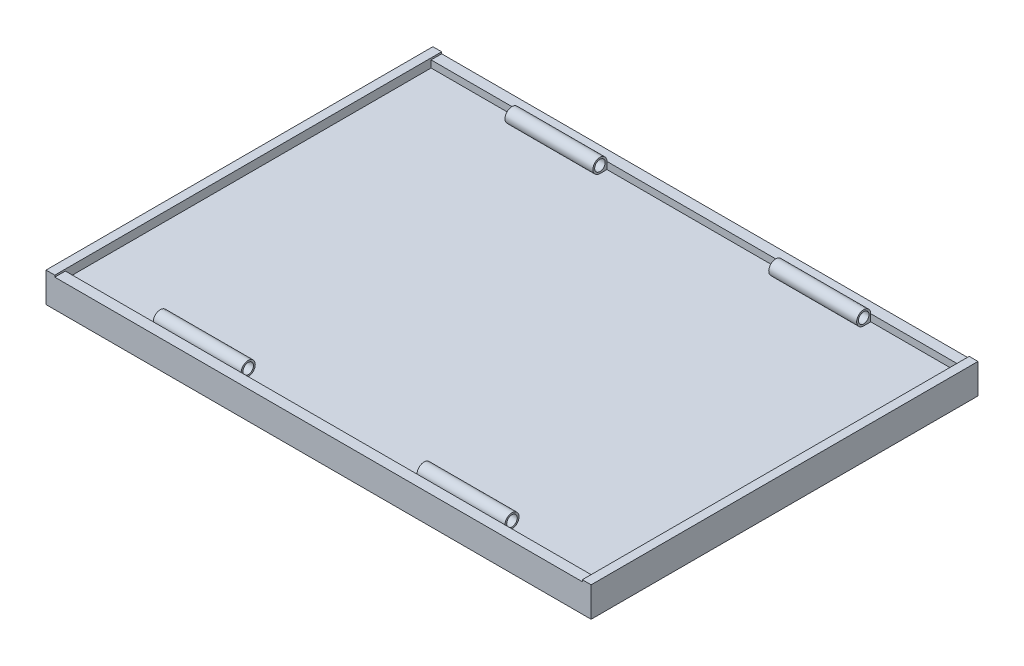
from build123d import *

# Parameters (mm, degrees)
SKETCH_1_W                 = 310
SKETCH_1_H                 = 220
EXTRUDE_1_DEPTH            = 12
SKETCH_8_W                 = 310
SKETCH_8_H                 = 10
EXTRUDE_12_DEPTH           = 4
SKETCH_10_R                = 4
CUT_EXTRUDE_5_DEPTH        = 305
SKETCH_11_W                = 4
SKETCH_11_H                = 4
EXTRUDE_13_DEPTH           = 5
EXTRUDE_START              = 300
SKETCH_12_R                = 4
SKETCH_12_R_2              = 3
EXTRUDE_1_2_DEPTH          = 300
SPLIT_START                = -49.339622642
SPLIT_BODIES_2_OUTLINE_R   = 3
SPLIT_BODIES_2_DEPTH       = 100
SPLIT_START_2              = -149.339622642
SPLIT_BODIES_2_2_OUTLINE_R = 3
SPLIT_BODIES_2_2_DEPTH     = 50
SPLIT_START_3              = 100.660377358
SPLIT_BODIES_2_3_OUTLINE_R = 3
SPLIT_BODIES_2_3_DEPTH     = 50
SKETCH_14_W                = 50
SKETCH_14_H                = 8
SKETCH_14_W_2              = 100
EXTRUDE_14_DEPTH           = 12
SKETCH_15_W                = 5
SKETCH_15_H                = 220
EXTRUDE_15_DEPTH           = 5


# Read off the part's stored shape, not the designer's step: 分割2
with BuildPart() as part:
    # 草图1 → Extrude 1 (new body)
    with BuildSketch(Plane(origin=(0, 0, 0), x_dir=(1, 0, 0), z_dir=(0, 1, 0))):
        with Locations((0.660377358, 22.830188679)):
            Rectangle(SKETCH_1_W, SKETCH_1_H)
    extrude(amount=EXTRUDE_1_DEPTH)

    # 草图8 → 凸台-拉伸12 (add)
    with BuildSketch(Plane(origin=(0, 12, 0), x_dir=(1, 0, 0), z_dir=(0, 1, 0))):
        with Locations((0.660377358, 127.830188679)):
            Rectangle(SKETCH_8_W, SKETCH_8_H)
        with Locations((0.660377358, -82.169811321)):
            Rectangle(SKETCH_8_W, SKETCH_8_H)
    extrude(amount=EXTRUDE_12_DEPTH)

    # 草图10 → 切除-拉伸5 (cut)
    with BuildSketch(Plane(origin=(155.660377358, 0, 0), x_dir=(0, 0, -1), z_dir=(1, 0, 0))):
        with Locations((-77.169811321, 16)):
            Circle(SKETCH_10_R)
        with Locations((122.830188679, 16)):
            Circle(SKETCH_10_R)
    extrude(amount=-CUT_EXTRUDE_5_DEPTH, mode=Mode.SUBTRACT)

    # 草图11 → 凸台-拉伸13 (add)
    with BuildSketch(Plane(origin=(155.660377358, 0, 0), x_dir=(0, 0, -1), z_dir=(1, 0, 0))):
        with Locations((-79.169811321, 14)):
            Rectangle(SKETCH_11_W, SKETCH_11_H)
        with Locations((124.830188679, 14)):
            Rectangle(SKETCH_11_W, SKETCH_11_H)
    extrude(amount=-EXTRUDE_13_DEPTH)

    # 草图12 → Extrude 1 2 (add)
    # profile 1 of 2: a face of its own
    with BuildSketch(Plane(origin=(-149.339622642, 0, 0), x_dir=(0, 0, -1), z_dir=(1, 0, 0)).offset(EXTRUDE_START)):
        with Locations((-77.169811321, 16)):
            Circle(SKETCH_12_R)
        with Locations((-77.169811321, 16)):
            Circle(SKETCH_12_R_2, mode=Mode.SUBTRACT)
    # profile 2 of 2: a face of its own
    with BuildSketch(Plane(origin=(-149.339622642, 0, 0), x_dir=(0, 0, -1), z_dir=(1, 0, 0)).offset(EXTRUDE_START)):
        with Locations((122.830188679, 16)):
            Circle(SKETCH_12_R)
        with Locations((122.830188679, 16)):
            Circle(SKETCH_12_R_2, mode=Mode.SUBTRACT)
    extrude(amount=-EXTRUDE_1_2_DEPTH)

    # Split Bodies 2 outline → Split Bodies 2 (cut)
    # profile 1 of 2: a face of its own
    with BuildSketch(Plane.YZ.offset(SPLIT_START)):
        with BuildLine():
            Line((12, -122.830188679), (12, -118.830188679))
            Line((12, -118.830188679), (0, -118.830188679))
            Line((0, -118.830188679), (0, -126.830188679))
            Line((0, -126.830188679), (16, -126.830188679))
            ThreePointArc((16, -126.830188679), (18.828427125, -120.001761554), (12, -122.830188679))
        make_face()
        with Locations((16, -122.830188679)):
            Circle(SPLIT_BODIES_2_OUTLINE_R, mode=Mode.SUBTRACT)
    # profile 2 of 2: a face of its own
    with BuildSketch(Plane.YZ.offset(SPLIT_START)):
        with BuildLine():
            Line((0, 73.169811321), (12, 73.169811321))
            Line((12, 73.169811321), (12, 77.169811321))
            ThreePointArc((12, 77.169811321), (18.828427125, 74.341384196), (16, 81.169811321))
            Line((16, 81.169811321), (0, 81.169811321))
            Line((0, 81.169811321), (0, 73.169811321))
        make_face()
        with Locations((16, 77.169811321)):
            Circle(SPLIT_BODIES_2_OUTLINE_R, mode=Mode.SUBTRACT)
    extrude(amount=SPLIT_BODIES_2_DEPTH, mode=Mode.SUBTRACT)

    # Split Bodies 2 2 outline → Split Bodies 2 2 (cut)
    # profile 1 of 2: a face of its own
    with BuildSketch(Plane.YZ.offset(SPLIT_START_2)):
        with BuildLine():
            Line((12, -122.830188679), (12, -118.830188679))
            Line((12, -118.830188679), (0, -118.830188679))
            Line((0, -118.830188679), (0, -126.830188679))
            Line((0, -126.830188679), (16, -126.830188679))
            ThreePointArc((16, -126.830188679), (18.828427125, -120.001761554), (12, -122.830188679))
        make_face()
        with Locations((16, -122.830188679)):
            Circle(SPLIT_BODIES_2_2_OUTLINE_R, mode=Mode.SUBTRACT)
    # profile 2 of 2: a face of its own
    with BuildSketch(Plane.YZ.offset(SPLIT_START_2)):
        with BuildLine():
            Line((0, 73.169811321), (12, 73.169811321))
            Line((12, 73.169811321), (12, 77.169811321))
            ThreePointArc((12, 77.169811321), (18.828427125, 74.341384196), (16, 81.169811321))
            Line((16, 81.169811321), (0, 81.169811321))
            Line((0, 81.169811321), (0, 73.169811321))
        make_face()
        with Locations((16, 77.169811321)):
            Circle(SPLIT_BODIES_2_2_OUTLINE_R, mode=Mode.SUBTRACT)
    extrude(amount=SPLIT_BODIES_2_2_DEPTH, mode=Mode.SUBTRACT)

    # Split Bodies 2 3 outline → Split Bodies 2 3 (cut)
    # profile 1 of 2: a face of its own
    with BuildSketch(Plane.YZ.offset(SPLIT_START_3)):
        with BuildLine():
            Line((12, -122.830188679), (12, -118.830188679))
            Line((12, -118.830188679), (0, -118.830188679))
            Line((0, -118.830188679), (0, -126.830188679))
            Line((0, -126.830188679), (16, -126.830188679))
            ThreePointArc((16, -126.830188679), (18.828427125, -120.001761554), (12, -122.830188679))
        make_face()
        with Locations((16, -122.830188679)):
            Circle(SPLIT_BODIES_2_3_OUTLINE_R, mode=Mode.SUBTRACT)
    # profile 2 of 2: a face of its own
    with BuildSketch(Plane.YZ.offset(SPLIT_START_3)):
        with BuildLine():
            Line((0, 73.169811321), (12, 73.169811321))
            Line((12, 73.169811321), (12, 77.169811321))
            ThreePointArc((12, 77.169811321), (18.828427125, 74.341384196), (16, 81.169811321))
            Line((16, 81.169811321), (0, 81.169811321))
            Line((0, 81.169811321), (0, 73.169811321))
        make_face()
        with Locations((16, 77.169811321)):
            Circle(SPLIT_BODIES_2_3_OUTLINE_R, mode=Mode.SUBTRACT)
    extrude(amount=SPLIT_BODIES_2_3_DEPTH, mode=Mode.SUBTRACT)

    # 草图14 → 凸台-拉伸14 (add)
    with BuildSketch(Plane(origin=(0, 12, 0), x_dir=(1, 0, 0), z_dir=(0, 1, 0))):
        with Locations((-124.339622642, 122.830188679)):
            Rectangle(SKETCH_14_W, SKETCH_14_H)
        with Locations((125.660377358, 122.830188679)):
            Rectangle(SKETCH_14_W, SKETCH_14_H)
        with Locations((-124.339622642, -77.169811321)):
            Rectangle(SKETCH_14_W, SKETCH_14_H)
        with Locations((125.660377358, -77.169811321)):
            Rectangle(SKETCH_14_W, SKETCH_14_H)
        with Locations((0.660377358, -77.169811321)):
            Rectangle(SKETCH_14_W_2, SKETCH_14_H)
        with Locations((0.660377358, 122.830188679)):
            Rectangle(SKETCH_14_W_2, SKETCH_14_H)
    extrude(amount=-EXTRUDE_14_DEPTH)

    # 草图15 → 凸台-拉伸15 (add)
    with BuildSketch(Plane(origin=(0, 12, 0), x_dir=(1, 0, 0), z_dir=(0, 1, 0))):
        with Locations((-151.839622642, 22.830188679)):
            Rectangle(SKETCH_15_W, SKETCH_15_H)
        with Locations((153.160377358, 22.830188679)):
            Rectangle(SKETCH_15_W, SKETCH_15_H)
    extrude(amount=EXTRUDE_15_DEPTH)


solid = part.part
